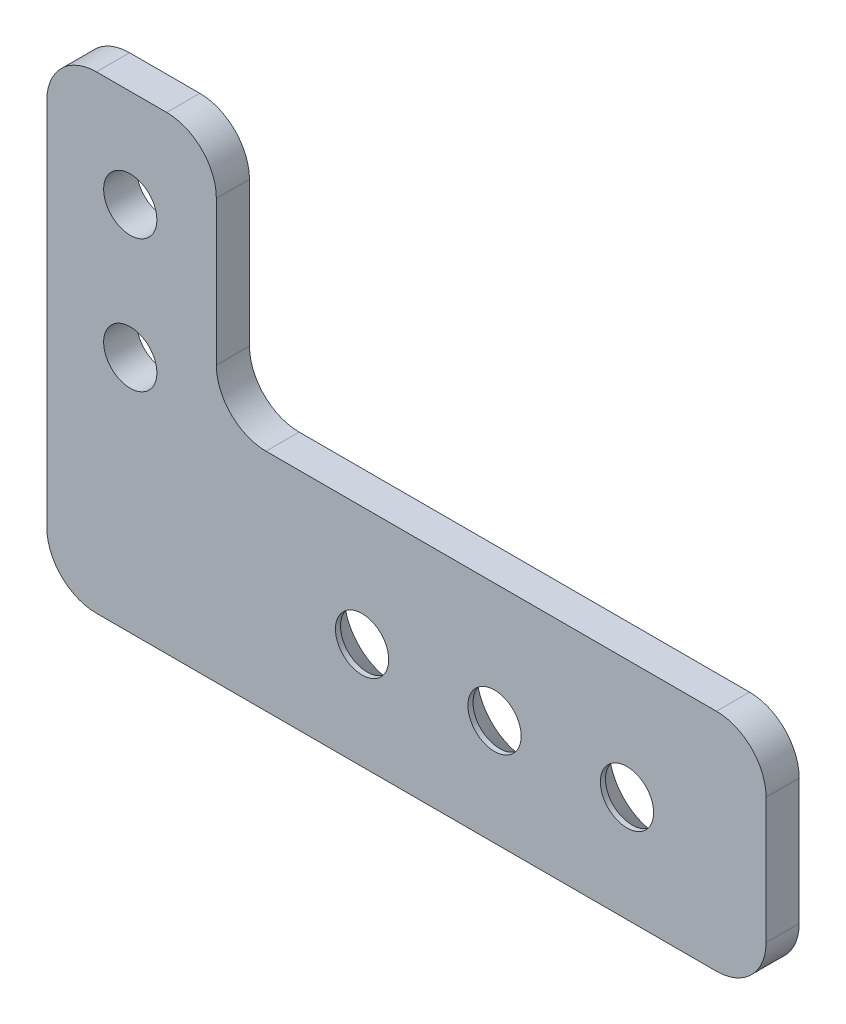
from build123d import *

# Parameters (mm, degrees)
SKETCH1_R                                    = 2.5527
BOSS_EXTRUDE1_DEPTH                          = 3.175
FILLET1_R                                    = 4.7625
CSK_FOR_10_FLAT_HEAD_MACHINE_SCREW3_AT_COUNT = 2
CSK_FOR_10_FLAT_HEAD_MACHINE_SCREW3_AT_PITCH = 12.7
CSK_FOR_10_FLAT_HEAD_MACHINE_SCREW3_2_COUNT  = 2
CSK_FOR_10_FLAT_HEAD_MACHINE_SCREW3_2_PITCH  = 25.4


with BuildPart() as part:
    # Sketch1 → Boss-Extrude1 (new body)
    with BuildSketch(Plane.XY):
        Polygon((-30.5435, 23.749), (-30.5435, -21.209), (38.4175, -21.209), (38.4175, 0.381), (-14.2875, 0.381), (-14.2875, 23.749), align=None)
        with Locations((-22.5425, 1.651)):
            Circle(SKETCH1_R, mode=Mode.SUBTRACT)
        with Locations((-22.5425, 14.351)):
            Circle(SKETCH1_R, mode=Mode.SUBTRACT)
    extrude(amount=BOSS_EXTRUDE1_DEPTH)

    # Fillet1
    fillet1_edges = [part.edges().sort_by_distance(p)[0] for p in [
        (-30.5435, 23.749, 1.5875),
        (-14.2875, 23.749, 1.5875),
        (-14.2875, 0.381, 1.5875),
        (38.4175, 0.381, 1.5875),
        (38.4175, -21.209, 1.5875),
        (-30.5435, -21.209, 1.5875),
    ]]
    fillet(fillet1_edges, radius=FILLET1_R)

    # Sketch7 → CSK for #10 Flat Head Machine Screw3 (revolve, cut)
    with BuildSketch(Plane(origin=(25.0825, -11.049, 0), x_dir=(0, 1, 0), z_dir=(1, 0, 0))):
        Polygon((0, 0), (0, 3.175), (2.5527, 3.175), (2.5527, 2.688180894), (4.8895, 0), align=None)
    csk_for_10_flat_head_machine_screw3 = revolve(axis=Axis((25.0825, -11.049, -6.35), (0, 0, 1)), mode=Mode.SUBTRACT)

    # CSK for #10 Flat Head Machine Screw3 at: CSK for #10 Flat Head Machine Screw3 ×2
    with Locations(*[(-i * CSK_FOR_10_FLAT_HEAD_MACHINE_SCREW3_AT_PITCH, 0, 0) for i in range(1, CSK_FOR_10_FLAT_HEAD_MACHINE_SCREW3_AT_COUNT)]):
        add(csk_for_10_flat_head_machine_screw3, mode=Mode.SUBTRACT)

    # CSK for _10 Flat Head Machine Screw3 2: CSK for #10 Flat Head Machine Screw3 ×2
    with Locations(*[(-i * CSK_FOR_10_FLAT_HEAD_MACHINE_SCREW3_2_PITCH, 0, 0) for i in range(1, CSK_FOR_10_FLAT_HEAD_MACHINE_SCREW3_2_COUNT)]):
        add(csk_for_10_flat_head_machine_screw3, mode=Mode.SUBTRACT)


solid = part.part
